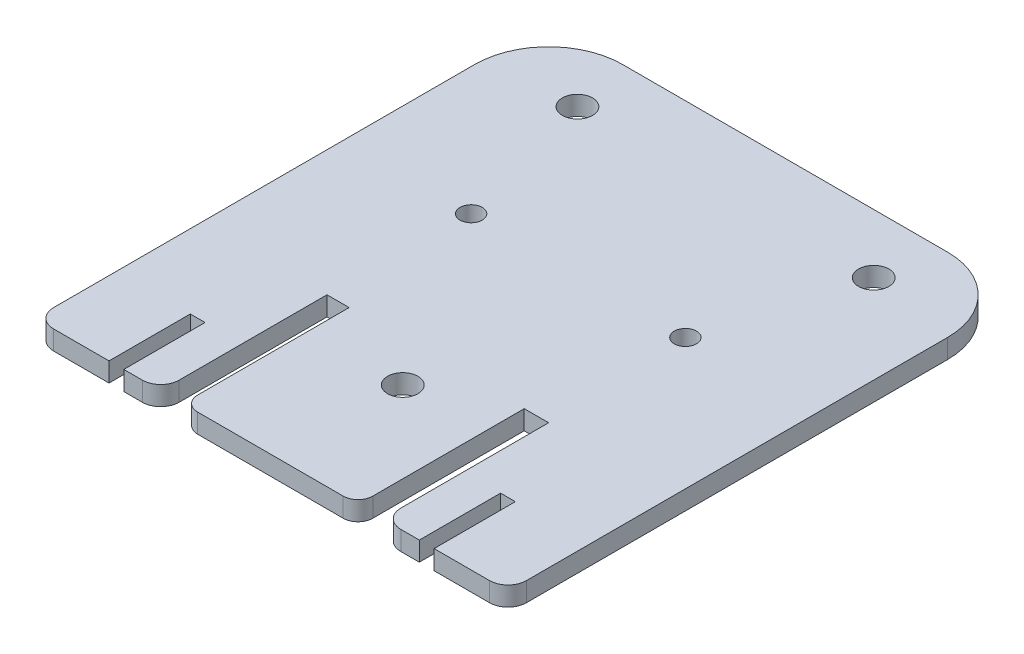
from build123d import *

# Parameters (mm, degrees)
MAIN_BODY_DEPTH          = 2.6
SCREW_HOLES_DEPTH        = 57.095989161
SCREW_HOLES_DEPTH_BACK   = 57.095989161
SKETCH2_R                = 2.05
SKETCH2_R_2              = 1.5
MAIN_LOWER_BODY_FILLET_R = 2
SKETCH5_W                = 17
SKETCH5_H                = 2.6
BOSS_EXTRUDE1_DEPTH      = 22.5
SKETCH6_W                = 2
SKETCH6_H                = 11
CUT_EXTRUDE1_DEPTH       = 22.5
FILLET2_R                = 2.5


with BuildPart() as part:
    # Sketch1 → Main Body (new body)
    with BuildSketch(Plane(origin=(0, 0, 0), x_dir=(1, 0, 0), z_dir=(0, 1, 0))):
        with BuildLine():
            Line((11.7, -23.5), (32, -23.5))
            Line((32, -23.5), (32, 13.5))
            ThreePointArc((32, 13.5), (29.071067812, 20.571067812), (22, 23.5))
            Line((22, 23.5), (-22, 23.5))
            ThreePointArc((-22, 23.5), (-29.071067812, 20.571067812), (-32, 13.5))
            Line((-32, 13.5), (-32, -23.5))
            Line((-32, -23.5), (-12, -23.5))
            Line((-12, -23.5), (-12, -46))
            Line((-12, -46), (11.7, -46))
            Line((11.7, -46), (11.7, -23.5))
        make_face()
    extrude(amount=MAIN_BODY_DEPTH)

    # Sketch2 → Screw holes (cut, two sides: drawn at the far end of the back side and taken through both)
    with BuildSketch(Plane(origin=(0, 2.6, 0), x_dir=(1, 0, 0), z_dir=(0, 1, 0)).offset(-SCREW_HOLES_DEPTH_BACK)):
        with Locations((-20.1, 15.4999906)):
            Circle(SKETCH2_R)
        with Locations((20, 15.5)):
            Circle(SKETCH2_R)
        with Locations((-14.740009048, -4.250009446)):
            Circle(SKETCH2_R_2)
        with Locations((14.259990952, -4.250009446)):
            Circle(SKETCH2_R_2)
        with Locations((0.7, -28.9500094)):
            Circle(SKETCH2_R)
    extrude(amount=SCREW_HOLES_DEPTH + SCREW_HOLES_DEPTH_BACK, mode=Mode.SUBTRACT)

    # Main lower body Fillet
    main_lower_body_fillet_edges = [part.edges().sort_by_distance(p)[0] for p in [
        (11.7, 1.3, 46),
        (-12, 1.3, 46),
    ]]
    fillet(main_lower_body_fillet_edges, radius=MAIN_LOWER_BODY_FILLET_R)

    # Sketch5 → Boss-Extrude1 (add)
    with BuildSketch(Plane.XY.offset(23.5)):
        with Locations((-23.5, 1.3)):
            Rectangle(SKETCH5_W, SKETCH5_H)
        with Locations((23.5, 1.3)):
            Rectangle(SKETCH5_W, SKETCH5_H)
    extrude(amount=BOSS_EXTRUDE1_DEPTH)

    # Sketch6 → Cut-Extrude1 (cut)
    with BuildSketch(Plane(origin=(0, 2.6, 0), x_dir=(1, 0, 0), z_dir=(0, 1, 0))):
        with Locations((-21, -40.5)):
            Rectangle(SKETCH6_W, SKETCH6_H)
        with Locations((21, -40.5)):
            Rectangle(SKETCH6_W, SKETCH6_H)
    extrude(amount=-CUT_EXTRUDE1_DEPTH, mode=Mode.SUBTRACT)

    # Fillet2
    fillet2_edges = [part.edges().sort_by_distance(p)[0] for p in [
        (-32, 1.3, 46),
        (-15, 1.3, 46),
        (15, 1.3, 46),
        (32, 1.3, 46),
    ]]
    fillet(fillet2_edges, radius=FILLET2_R)


solid = part.part
